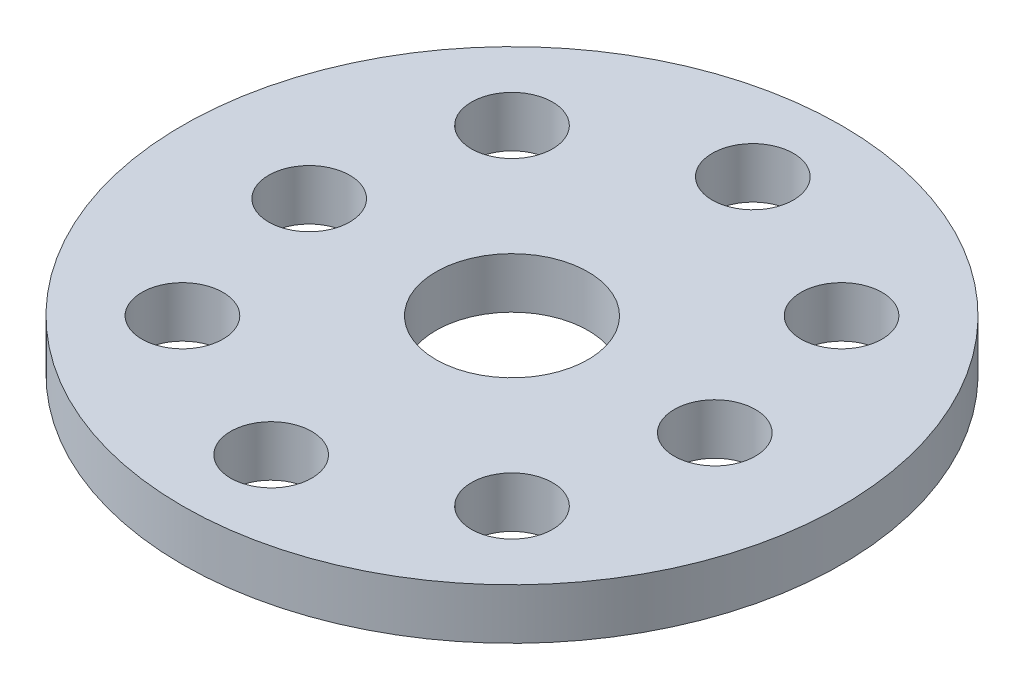
from build123d import *

# Parameters (mm, degrees)
SKETCH_1_R          = 13
SKETCH_1_R_2        = 1.6
EXTRUDE_1_DEPTH     = 2
SKETCH_2_R          = 1.6
SKETCH_2_R_2        = 3
CUT_EXTRUDE_1_DEPTH = 19.493242009


with BuildPart() as part:
    # 草图1 → 凸台-拉伸1 (new body)
    with BuildSketch(Plane(origin=(0, 0, 0), x_dir=(1, 0, 0), z_dir=(0, 1, 0))):
        Circle(SKETCH_1_R)
        with Locations((0, 9.5)):
            Circle(SKETCH_1_R_2, mode=Mode.SUBTRACT)
        with Locations((8, 0)):
            Circle(SKETCH_1_R_2, mode=Mode.SUBTRACT)
        with Locations((-8, 0)):
            Circle(SKETCH_1_R_2, mode=Mode.SUBTRACT)
        with Locations((0, -9.5)):
            Circle(SKETCH_1_R_2, mode=Mode.SUBTRACT)
    extrude(amount=EXTRUDE_1_DEPTH)

    # 草图2 → 切除-拉伸1 (cut, through all)
    with BuildSketch(Plane(origin=(0, 2, 0), x_dir=(1, 0, 0), z_dir=(0, 1, 0))):
        with Locations((6.5, 6.5)):
            Circle(SKETCH_2_R)
        with Locations((6.5, -6.5)):
            Circle(SKETCH_2_R)
        with Locations((-6.5, -6.5)):
            Circle(SKETCH_2_R)
        with Locations((-6.5, 6.5)):
            Circle(SKETCH_2_R)
        Circle(SKETCH_2_R_2)
    extrude(amount=-CUT_EXTRUDE_1_DEPTH, mode=Mode.SUBTRACT)


solid = part.part
